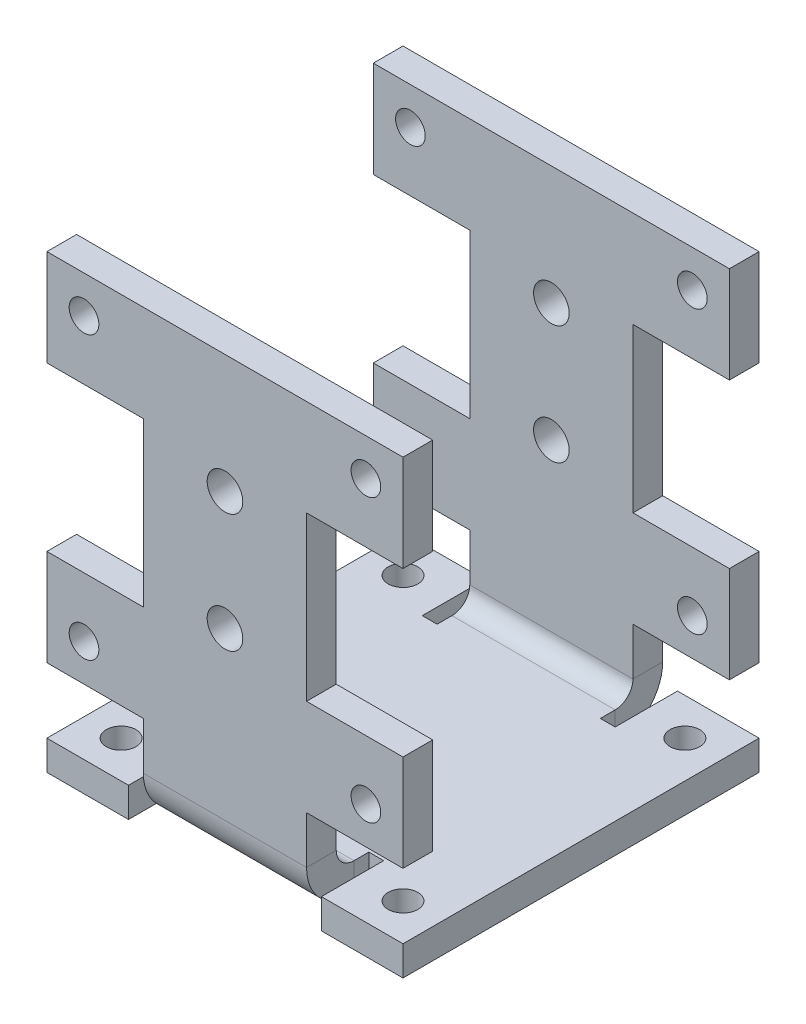
from build123d import *

# Parameters (mm, degrees)
SKETCH_16_R                       = 2.5
SM_BASE_FLANGE_2_DEPTH            = 5
SM_EDGE_FLANGE_1_STRIP_W          = 26
SM_EDGE_FLANGE_1_STRIP_H          = 5
SM_EDGE_FLANGE_1_STRIP_CUT_DEPTH  = 27.5
SM_EDGE_FLANGE_1_RELIEF_W         = 28.5
SM_EDGE_FLANGE_1_RELIEF_H         = 2.5
SM_EDGE_FLANGE_1_RELIEF_CUT_DEPTH = 5
SM_EDGE_FLANGE_1_DEPTH            = 27.5
SM_EDGE_FLANGE_2_STRIP_W          = 26
SM_EDGE_FLANGE_2_STRIP_H          = 5
SM_EDGE_FLANGE_2_STRIP_CUT_DEPTH  = 27.5
SM_EDGE_FLANGE_2_RELIEF_W         = 28.5
SM_EDGE_FLANGE_2_RELIEF_H         = 2.5
SM_EDGE_FLANGE_2_RELIEF_CUT_DEPTH = 5
SM_EDGE_FLANGE_2_DEPTH            = 27.5
EXTRUDE_START                     = 30
SKETCH_23_W                       = 16.25
SKETCH_23_H                       = 16.25
EXTRUDE_1_DEPTH                   = 5
EXTRUDE_START_2                   = -25
SKETCH_24_W                       = 16.25
SKETCH_24_H                       = 16.25
EXTRUDE_2_DEPTH                   = 5
CUT_EXTRUDE_1_DEPTH               = 83.710337927
CUT_EXTRUDE_1_DEPTH_BACK          = 83.710337927
SKETCH_25_R                       = 2.5
CUT_EXTRUDE_2_DEPTH               = 83.710337927
CUT_EXTRUDE_2_DEPTH_BACK          = 83.710337927
SKETCH_26_R                       = 3


# Sheet-metal steps are written as plain solids
with BuildPart() as part:
    # 草图16 → 基体-法兰2 (new body)
    with BuildSketch(Plane(origin=(0, 0, 0), x_dir=(1, 0, 0), z_dir=(0, 1, 0))):
        Polygon((16.25, 30), (30, 30), (30, -30), (16.25, -30), (16.25, -25), (-16.25, -25), (-16.25, -30), (-30, -30), (-30, 30), (-16.25, 30), (-16.25, 25), (16.25, 25), align=None)
        with Locations(Location((-23.75, 23.75, 0), (0, 0, 270))):
            Circle(SKETCH_16_R, mode=Mode.SUBTRACT)
        with Locations(Location((-23.75, -23.75, 0), (0, 0, 270))):
            Circle(SKETCH_16_R, mode=Mode.SUBTRACT)
        with Locations(Location((23.75, 23.75, 0), (0, 0, 270))):
            Circle(SKETCH_16_R, mode=Mode.SUBTRACT)
        with Locations(Location((23.75, -23.75, 0), (0, 0, 270))):
            Circle(SKETCH_16_R, mode=Mode.SUBTRACT)
    extrude(amount=-SM_BASE_FLANGE_2_DEPTH)

    # 边线-法兰1 strip (across the edge) → 边线-法兰1 strip cut (cut)
    with BuildSketch(Plane(origin=(-13.75, 0, 25), x_dir=(0, 0, -1), z_dir=(1, 0, 0))):
        with Locations((-10, -2.5)):
            Rectangle(SM_EDGE_FLANGE_1_STRIP_W, SM_EDGE_FLANGE_1_STRIP_H)
    extrude(amount=SM_EDGE_FLANGE_1_STRIP_CUT_DEPTH, mode=Mode.SUBTRACT)

    # 边线-法兰1 relief (on the sheet) → 边线-法兰1 relief cut (cut)
    with BuildSketch(Plane(origin=(-13.75, 0, 22), x_dir=(0, 0, -1), z_dir=(0, 1, 0))):
        with Locations((-11.75, 1.25)):
            Rectangle(SM_EDGE_FLANGE_1_RELIEF_W, SM_EDGE_FLANGE_1_RELIEF_H)
        with Locations((-11.75, -28.75)):
            Rectangle(SM_EDGE_FLANGE_1_RELIEF_W, SM_EDGE_FLANGE_1_RELIEF_H)
    extrude(amount=-SM_EDGE_FLANGE_1_RELIEF_CUT_DEPTH, mode=Mode.SUBTRACT)

    # 边线-法兰1 section (across the edge) → 边线-法兰1 (add)
    with BuildSketch(Plane(origin=(-13.75, 0, 25), x_dir=(0, 0, -1), z_dir=(1, 0, 0))):
        with BuildLine():
            Line((-5, 3), (-5, 71))
            Line((-5, 71), (0, 71))
            Line((0, 71), (0, 3))
            ThreePointArc((0, 3), (0.878679656, 0.878679656), (3, 0))
            Line((3, 0), (3, -5))
            ThreePointArc((3, -5), (-2.656854249, -2.656854249), (-5, 3))
        make_face()
    extrude(amount=SM_EDGE_FLANGE_1_DEPTH)

    # 边线-法兰2 strip (across the edge) → 边线-法兰2 strip cut (cut)
    with BuildSketch(Plane(origin=(13.75, 0, -25), x_dir=(0, 0, 1), z_dir=(-1, 0, 0))):
        with Locations((-10, -2.5)):
            Rectangle(SM_EDGE_FLANGE_2_STRIP_W, SM_EDGE_FLANGE_2_STRIP_H)
    extrude(amount=SM_EDGE_FLANGE_2_STRIP_CUT_DEPTH, mode=Mode.SUBTRACT)

    # 边线-法兰2 relief (on the sheet) → 边线-法兰2 relief cut (cut)
    with BuildSketch(Plane(origin=(13.75, 0, -22), x_dir=(0, 0, 1), z_dir=(0, 1, 0))):
        with Locations((-11.75, 1.25)):
            Rectangle(SM_EDGE_FLANGE_2_RELIEF_W, SM_EDGE_FLANGE_2_RELIEF_H)
        with Locations((-11.75, -28.75)):
            Rectangle(SM_EDGE_FLANGE_2_RELIEF_W, SM_EDGE_FLANGE_2_RELIEF_H)
    extrude(amount=-SM_EDGE_FLANGE_2_RELIEF_CUT_DEPTH, mode=Mode.SUBTRACT)

    # 边线-法兰2 section (across the edge) → 边线-法兰2 (add)
    with BuildSketch(Plane(origin=(13.75, 0, -25), x_dir=(0, 0, 1), z_dir=(-1, 0, 0))):
        with BuildLine():
            Line((-5, 3), (-5, 71))
            Line((-5, 71), (0, 71))
            Line((0, 71), (0, 3))
            ThreePointArc((0, 3), (0.878679656, 0.878679656), (3, 0))
            Line((3, 0), (3, -5))
            ThreePointArc((3, -5), (-2.656854249, -2.656854249), (-5, 3))
        make_face()
    extrude(amount=SM_EDGE_FLANGE_2_DEPTH)

    # 草图23 → 凸台-拉伸1 (add)
    with BuildSketch(Plane.XY.offset(EXTRUDE_START)):
        with Locations((-21.875, 62.875)):
            Rectangle(SKETCH_23_W, SKETCH_23_H)
        with Locations((21.875, 62.875)):
            Rectangle(SKETCH_23_W, SKETCH_23_H)
        with Locations((21.875, 19.125)):
            Rectangle(SKETCH_23_W, SKETCH_23_H)
        with Locations((-21.875, 19.125)):
            Rectangle(SKETCH_23_W, SKETCH_23_H)
    extrude(amount=-EXTRUDE_1_DEPTH)

    # 草图24 → 凸台-拉伸2 (add)
    with BuildSketch(Plane.XY.offset(EXTRUDE_START_2)):
        with Locations((21.875, 62.875)):
            Rectangle(SKETCH_24_W, SKETCH_24_H)
        with Locations((-21.875, 62.875)):
            Rectangle(SKETCH_24_W, SKETCH_24_H)
        with Locations((-21.875, 19.125)):
            Rectangle(SKETCH_24_W, SKETCH_24_H)
        with Locations((21.875, 19.125)):
            Rectangle(SKETCH_24_W, SKETCH_24_H)
    extrude(amount=-EXTRUDE_2_DEPTH)

    # 草图25 → 切除-拉伸1 (cut, two sides: drawn at the far end of the back side and taken through both)
    with BuildSketch(Plane.XY.offset(-CUT_EXTRUDE_1_DEPTH_BACK)):
        with Locations((-23.75, 64.75)):
            Circle(SKETCH_25_R)
        with Locations((23.75, 64.75)):
            Circle(SKETCH_25_R)
        with Locations((-23.75, 17.25)):
            Circle(SKETCH_25_R)
        with Locations((23.75, 17.25)):
            Circle(SKETCH_25_R)
    extrude(amount=CUT_EXTRUDE_1_DEPTH + CUT_EXTRUDE_1_DEPTH_BACK, mode=Mode.SUBTRACT)

    # 草图26 → 切除-拉伸2 (cut, two sides: drawn at the far end of the back side and taken through both)
    with BuildSketch(Plane.XY.offset(-CUT_EXTRUDE_2_DEPTH_BACK)):
        with Locations((0, 51)):
            Circle(SKETCH_26_R)
        with Locations((0, 31)):
            Circle(SKETCH_26_R)
    extrude(amount=CUT_EXTRUDE_2_DEPTH + CUT_EXTRUDE_2_DEPTH_BACK, mode=Mode.SUBTRACT)


solid = part.part
